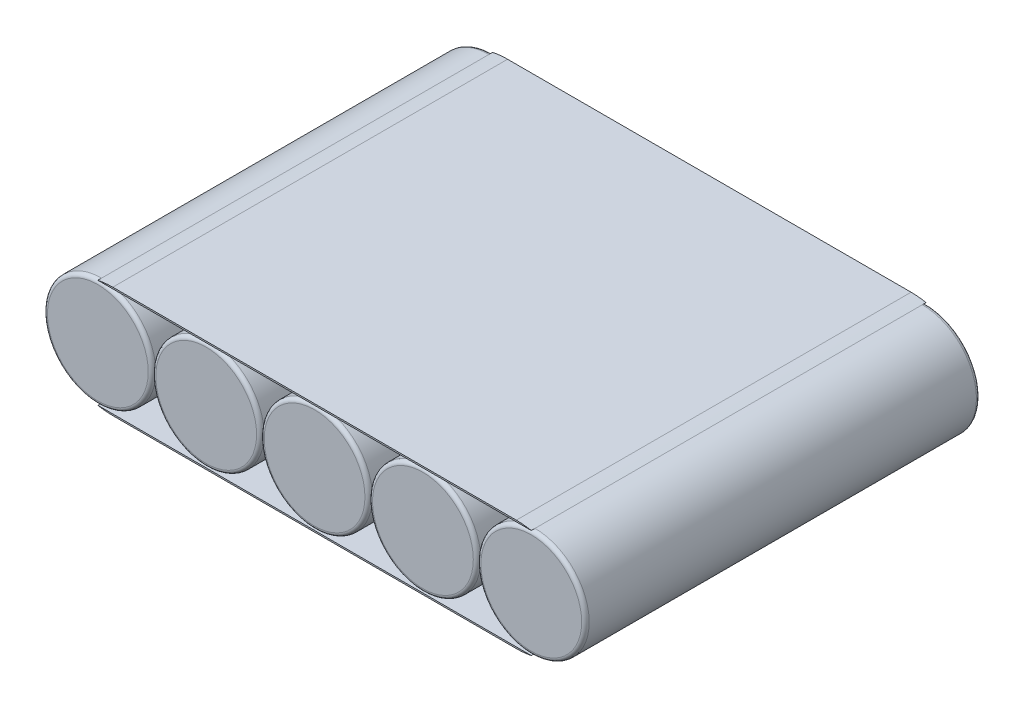
from build123d import *

# Parameters (mm, degrees)
SKETCH1_R             = 7.2
BOSS_EXTRUDE1_DEPTH   = 52.5
BOSS_EXTRUDE1_2_DEPTH = 52.5
BOSS_EXTRUDE1_3_DEPTH = 52.5
BOSS_EXTRUDE1_4_DEPTH = 52.5
BOSS_EXTRUDE1_5_DEPTH = 52.5
SKETCH3_W             = 57.64
SKETCH3_H             = 52.5
BOSS_EXTRUDE2_DEPTH   = 0.2
SKETCH5_W             = 57.64
SKETCH5_H             = 52.5
BOSS_EXTRUDE3_DEPTH   = 0.2
FILLET2_R             = 10
FILLET3_R             = 10
FILLET4_R             = 0.5
FILLET5_R             = 0.5
FILLET6_R             = 0.5
FILLET7_R             = 0.5
FILLET8_R             = 0.5


with BuildPart() as part:
    # Sketch1 → Boss-Extrude1 (new body)
    with BuildSketch(Plane.XY):
        Circle(SKETCH1_R)
    extrude(amount=BOSS_EXTRUDE1_DEPTH)

    # Fillet6
    fillet6_edges = [part.edges().sort_by_distance(p)[0] for p in [
        (-7.2, 0, 0),
        (-7.2, 0, 52.5),
    ]]
    fillet(fillet6_edges, radius=FILLET6_R)


with BuildPart() as body_2:
    # Sketch1 → Boss-Extrude1 2 (new body)
    with BuildSketch(Plane.XY):
        with Locations((-14.41, 0)):
            Circle(SKETCH1_R)
    extrude(amount=BOSS_EXTRUDE1_2_DEPTH)

    # Fillet5
    fillet5_edges = [body_2.edges().sort_by_distance(p)[0] for p in [
        (-21.61, 0, 0),
        (-21.61, 0, 52.5),
    ]]
    fillet(fillet5_edges, radius=FILLET5_R)


with BuildPart() as body_3:
    # Sketch1 → Boss-Extrude1 3 (new body)
    with BuildSketch(Plane.XY):
        with Locations((-28.82, 0)):
            Circle(SKETCH1_R)
    extrude(amount=BOSS_EXTRUDE1_3_DEPTH)

    # Fillet4
    fillet4_edges = [body_3.edges().sort_by_distance(p)[0] for p in [
        (-36.02, 0, 0),
        (-36.02, 0, 52.5),
    ]]
    fillet(fillet4_edges, radius=FILLET4_R)


with BuildPart() as body_4:
    # Sketch1 → Boss-Extrude1 4 (new body)
    with BuildSketch(Plane.XY):
        with Locations((14.41, 0)):
            Circle(SKETCH1_R)
    extrude(amount=BOSS_EXTRUDE1_4_DEPTH)

    # Fillet7
    fillet7_edges = [body_4.edges().sort_by_distance(p)[0] for p in [
        (7.21, 0, 0),
        (7.21, 0, 52.5),
    ]]
    fillet(fillet7_edges, radius=FILLET7_R)


with BuildPart() as body_5:
    # Sketch1 → Boss-Extrude1 5 (new body)
    with BuildSketch(Plane.XY):
        with Locations((28.82, 0)):
            Circle(SKETCH1_R)
    extrude(amount=BOSS_EXTRUDE1_5_DEPTH)

    # Fillet8
    fillet8_edges = [body_5.edges().sort_by_distance(p)[0] for p in [
        (21.62, 0, 0),
        (21.62, 0, 52.5),
    ]]
    fillet(fillet8_edges, radius=FILLET8_R)


with BuildPart() as body_6:
    # Sketch3 → Boss-Extrude2 (new body)
    with BuildSketch(Plane(origin=(0, 7.2, 0), x_dir=(1, 0, 0), z_dir=(0, 1, 0))):
        with Locations((0, -26.25)):
            Rectangle(SKETCH3_W, SKETCH3_H)
    extrude(amount=BOSS_EXTRUDE2_DEPTH)

    # Fillet2
    # the kernel refuses this fillet: 10 mm, written as the material it takes off along each edge
    with BuildSketch(Plane(origin=(-28.82, 7.4, 57.474937186), x_dir=(0, -1, 0), z_dir=(0, 0, -1)), Plane(origin=(28.82, 7.4, -4.974937186), x_dir=(0, -1, 0), z_dir=(0, 0, 1))) as fillet2_piece_1:
        with BuildLine():
            CenterArc((10, -1.989974874), FILLET2_R, 168.521659045, 11.478340955)
            Line((0, -1.989974874), (-0.2, -1.989974874))
            Line((-0.2, -1.989974874), (-0.2, 0))
            Line((-0.2, 0), (0, 0.2))
            ThreePointArc((0, 0.2), (0.1, 0.2), (0.004, 0.039799497))
            Line((0.004, 0.039799497), (0.2, 0))
        make_face()
    extrude(amount=62.449874371, mode=Mode.SUBTRACT)


with BuildPart() as body_7:
    # Sketch5 → Boss-Extrude3 (new body)
    with BuildSketch(Plane(origin=(0, -7.2, 0), x_dir=(-1, 0, 0), z_dir=(0, -1, 0))):
        with Locations((0, -26.25)):
            Rectangle(SKETCH5_W, SKETCH5_H)
    extrude(amount=BOSS_EXTRUDE3_DEPTH)

    # Fillet3
    # the kernel refuses this fillet: 10 mm, written as the material it takes off along each edge
    with BuildSketch(Plane(origin=(28.82, -7.4, 57.474937186), x_dir=(0, 1, 0), z_dir=(0, 0, -1)), Plane(origin=(-28.82, -7.4, -4.974937186), x_dir=(0, 1, 0), z_dir=(0, 0, 1))) as fillet3_piece_1:
        with BuildLine():
            CenterArc((10, -1.989974874), FILLET3_R, 168.521659045, 11.478340955)
            Line((0, -1.989974874), (-0.2, -1.989974874))
            Line((-0.2, -1.989974874), (-0.2, 0))
            Line((-0.2, 0), (0, 0.2))
            ThreePointArc((0, 0.2), (0.1, 0.2), (0.004, 0.039799497))
            Line((0.004, 0.039799497), (0.2, 0))
        make_face()
    extrude(amount=62.449874371, mode=Mode.SUBTRACT)


solid = Compound([part.part, body_2.part, body_3.part, body_4.part, body_5.part, body_6.part, body_7.part])
